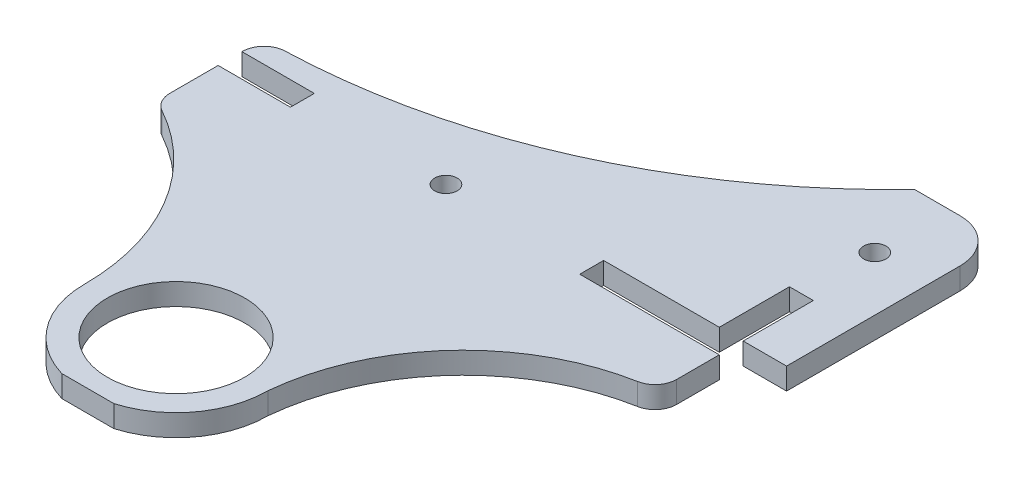
from build123d import *

# Parameters (mm, degrees)
CROQUIS1_R               = 1.55
CROQUIS1_R_2             = 9.5
SALIENTE_EXTRUIR10_DEPTH = 3
CORTAR_EXTRUIR2_START    = -3
CORTAR_EXTRUIR2_DEPTH    = 3
REDONDEO1_R              = 6
REDONDEO2_R              = 3


# Read off the part's stored shape, not the designer's step: Cortar-Extruir2
with BuildPart() as part:
    # Croquis1 → Saliente-Extruir10 (new body)
    with BuildSketch(Plane(origin=(0, 0, 0), x_dir=(1, 0, 0), z_dir=(0, 1, 0))):
        Polygon((0, 0), (0, 38.7), (10, 38.7), (10, 42), (0, 42), (0, 72), (69.3, 72), (75.3, 72), (75.3, 52), (75.3, 42), (69.3, 42), (69.3, 51.7), (66, 51.7), (66, 42), (50, 42), (50, 38.7), (69.3, 38.7), (69.3, 0), (69.3, -9), (0, -9), align=None)
        with Locations(Location((30, 40.2, 0), (0, 0, 270))):
            Circle(CROQUIS1_R, mode=Mode.SUBTRACT)
        with Locations(Location((67.8, 61.7, 0), (0, 0, 270))):
            Circle(CROQUIS1_R, mode=Mode.SUBTRACT)
        with Locations(Location((29.68, 3.2, 0), (0, 0, 270))):
            Circle(CROQUIS1_R_2, mode=Mode.SUBTRACT)
    extrude(amount=SALIENTE_EXTRUIR10_DEPTH)

    # Cortar-Extruir2 outline → Cortar-Extruir2 (cut)
    with BuildSketch(Plane(origin=(0, 3, 0), x_dir=(1, 0, 0), z_dir=(0, 1, 0)).offset(CORTAR_EXTRUIR2_START)):
        with BuildLine():
            ThreePointArc((26.080222229, -9), (19.492076432, -4.416075983), (16.96, 3.2))
            ThreePointArc((16.96, 3.2), (12.363945378, 19.139693097), (0, 30.2))
            Line((0, 30.2), (0, -9))
            Line((0, -9), (26.080222229, -9))
        make_face()
        with BuildLine():
            ThreePointArc((42.4, 3.2), (39.867923568, -4.416075983), (33.279777771, -9))
            Line((33.279777771, -9), (69.3, -9))
            Line((69.3, -9), (69.3, 30.2))
            ThreePointArc((69.3, 30.2), (51.011487425, 21.520592158), (42.4, 3.2))
        make_face()
        with BuildLine():
            Line((0, 72), (0, 45))
            ThreePointArc((0, 45), (34.270978976, 52.034382388), (63, 72))
            Line((63, 72), (0, 72))
        make_face()
    extrude(amount=CORTAR_EXTRUIR2_DEPTH, mode=Mode.SUBTRACT)

    # Redondeo1
    redondeo1_edges = [part.edges().sort_by_distance(p)[0] for p in [
        (75.3, 1.5, -72),
    ]]
    fillet(redondeo1_edges, radius=REDONDEO1_R)

    # Redondeo2
    redondeo2_edges = [part.edges().sort_by_distance(p)[0] for p in [
        (69.3, 1.5, -30.2),
        (0, 1.5, -45),
        (0, 1.5, -30.2),
    ]]
    fillet(redondeo2_edges, radius=REDONDEO2_R)


solid = part.part
